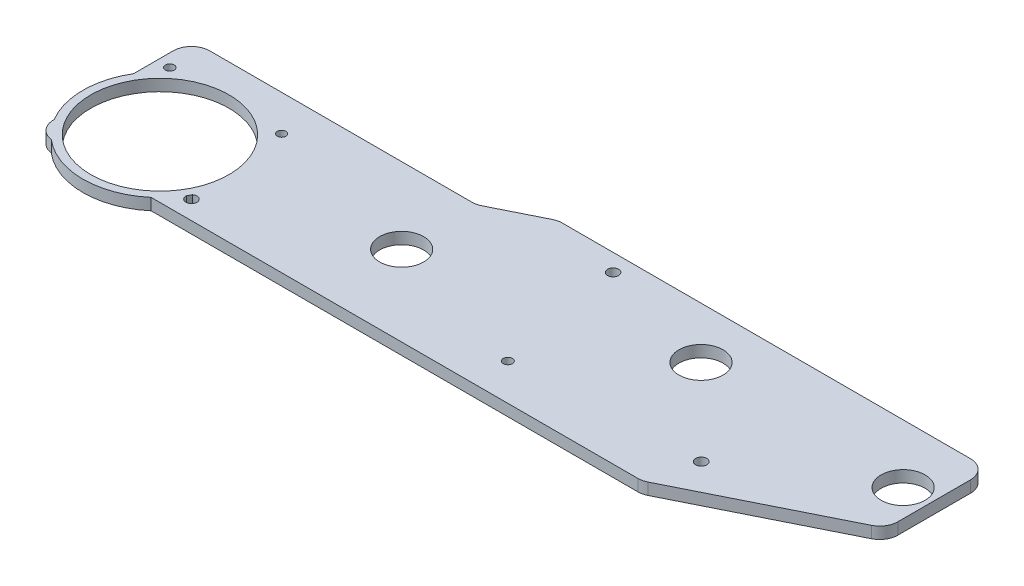
from build123d import *

# Parameters (mm, degrees)
SKETCH1_W           = 210
SKETCH1_H           = 50
SKETCH1_R           = 1.211665018
SKETCH1_R_2         = 1.165617118
SKETCH1_R_3         = 1.5
SKETCH1_R_4         = 1.25
SKETCH1_R_5         = 1.517273905
BOSS_EXTRUDE1_DEPTH = 3.175
SKETCH2_R           = 2
CUT_EXTRUDE1_DEPTH  = 10
SKETCH3_R           = 6
SKETCH3_R_2         = 0.586995366
CUT_EXTRUDE2_DEPTH  = 57.15
CUT_EXTRUDE7_DEPTH  = 10
FILLET3_R           = 5
SKETCH11_R          = 18.5
SKETCH11_R_2        = 2
BOSS_EXTRUDE4_DEPTH = 3.175
SKETCH12_R          = 21
BOSS_EXTRUDE5_DEPTH = 3.175
SKETCH13_R          = 18.85
CUT_EXTRUDE8_DEPTH  = 3.175


with BuildPart() as part:
    # Sketch1 → Boss-Extrude1 (new body)
    with BuildSketch(Plane(origin=(0, 0, 0), x_dir=(1, 0, 0), z_dir=(0, 1, 0))):
        with Locations((105, -25)):
            Rectangle(SKETCH1_W, SKETCH1_H)
        with Locations((3.489526233, -16.787661112)):
            Circle(SKETCH1_R, mode=Mode.SUBTRACT)
        with Locations((34.37258772, -17.194005245)):
            Circle(SKETCH1_R_2, mode=Mode.SUBTRACT)
        with Locations((37.520749958, -44.921198121)):
            Circle(SKETCH1_R_3, mode=Mode.SUBTRACT)
        with Locations((118.879039361, -40.017685043)):
            Circle(SKETCH1_R_4, mode=Mode.SUBTRACT)
        with Locations((112.302052499, -4.739260115)):
            Circle(SKETCH1_R_3, mode=Mode.SUBTRACT)
        with Locations((168.975233936, -37.403209633)):
            Circle(SKETCH1_R_5, mode=Mode.SUBTRACT)
    extrude(amount=BOSS_EXTRUDE1_DEPTH)

    # Sketch2 → Cut-Extrude1 (cut)
    with BuildSketch(Plane(origin=(0, 3.175, 0), x_dir=(1, 0, 0), z_dir=(0, 1, 0))):
        with Locations((10, -26)):
            Circle(SKETCH2_R)
        with Locations((10, -42)):
            Circle(SKETCH2_R)
        with Locations((26, -26)):
            Circle(SKETCH2_R)
        with Locations((26, -42)):
            Circle(SKETCH2_R)
    extrude(amount=-CUT_EXTRUDE1_DEPTH, mode=Mode.SUBTRACT)

    # Sketch3 → Cut-Extrude2 (cut)
    with BuildSketch(Plane(origin=(0, 3.175, 0), x_dir=(1, 0, 0), z_dir=(0, 1, 0))):
        with Locations((78.01026379, -28.1)):
            Circle(SKETCH3_R)
        with Locations((145.531297368, -14)):
            Circle(SKETCH3_R)
        with Locations((18, -34)):
            Circle(SKETCH3_R_2)
        with Locations((202.646291021, -16)):
            Circle(SKETCH3_R)
    extrude(amount=-CUT_EXTRUDE2_DEPTH, mode=Mode.SUBTRACT)

    # Sketch10 → Cut-Extrude7 (cut)
    with BuildSketch(Plane(origin=(0, 3.175, 0), x_dir=(1, 0, 0), z_dir=(0, 1, 0))):
        Polygon((210, -27.859435908), (165.502877994, -50), (210, -50), align=None)
        Polygon((92.532613397, 0), (77.65477062, -7.402812063), (0, -7.402812063), (0, 0), align=None)
    extrude(amount=-CUT_EXTRUDE7_DEPTH, mode=Mode.SUBTRACT)

    # Fillet3
    fillet3_edges = [part.edges().sort_by_distance(p)[0] for p in [
        (0, 1.5875, 50),
        (0, 1.5875, 7.402812063),
        (77.65477062, 1.5875, 7.402812063),
        (92.532613397, 1.5875, 0),
        (210, 1.5875, 0),
        (210, 1.5875, 27.859435908),
        (165.502877994, 1.5875, 50),
    ]]
    fillet(fillet3_edges, radius=FILLET3_R)

    # Sketch11 → Boss-Extrude4 (add)
    with BuildSketch(Plane(origin=(0, 3.175, 0), x_dir=(1, 0, 0), z_dir=(0, 1, 0))):
        with Locations((18, -34)):
            Circle(SKETCH11_R)
        with Locations((10, -26)):
            Circle(SKETCH11_R_2, mode=Mode.SUBTRACT)
        with Locations((10, -42)):
            Circle(SKETCH11_R_2, mode=Mode.SUBTRACT)
        with Locations((26, -26)):
            Circle(SKETCH11_R_2, mode=Mode.SUBTRACT)
        with Locations((26, -42)):
            Circle(SKETCH11_R_2, mode=Mode.SUBTRACT)
    extrude(amount=-BOSS_EXTRUDE4_DEPTH)

    # Sketch12 → Boss-Extrude5 (add)
    with BuildSketch(Plane(origin=(0, 3.175, 0), x_dir=(1, 0, 0), z_dir=(0, 1, 0))):
        with Locations((18, -34)):
            Circle(SKETCH12_R)
    extrude(amount=-BOSS_EXTRUDE5_DEPTH)

    # Sketch13 → Cut-Extrude8 (cut)
    with BuildSketch(Plane(origin=(0, 3.175, 0), x_dir=(1, 0, 0), z_dir=(0, 1, 0))):
        with Locations((18, -34)):
            Circle(SKETCH13_R)
    extrude(amount=-CUT_EXTRUDE8_DEPTH, mode=Mode.SUBTRACT)


solid = part.part
